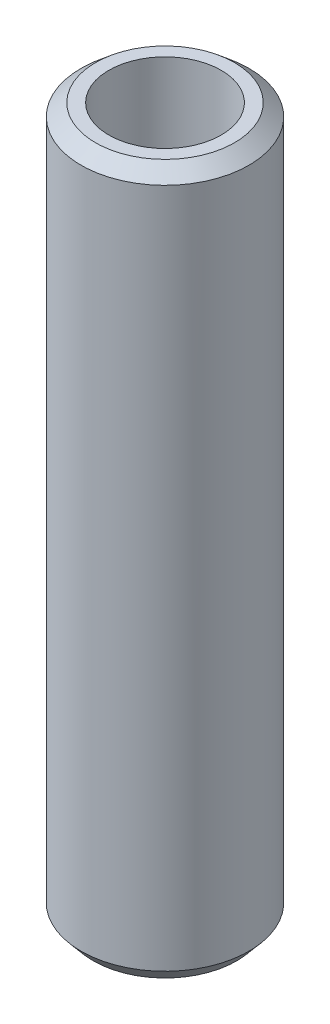
from build123d import *
from OCP.BRepFilletAPI import BRepFilletAPI_MakeChamfer

# Parameters (mm, degrees)
SKETCH1_R           = 20
BOSS_EXTRUDE1_DEPTH = 168.47988063
SKETCH2_R           = 13.376930258
CUT_EXTRUDE1_DEPTH  = 171.837554938
CHAMFER1_SIZE       = 2.912099767
CHAMFER1_SIZE2      = 3.450832047


with BuildPart() as part:
    # Sketch1 → Boss-Extrude1 (new body)
    with BuildSketch(Plane(origin=(0, 0, 0), x_dir=(1, 0, 0), z_dir=(0, 1, 0))):
        Circle(SKETCH1_R)
    extrude(amount=BOSS_EXTRUDE1_DEPTH)

    # Sketch2 → Cut-Extrude1 (cut, through all)
    with BuildSketch(Plane(origin=(0, 0, 0), x_dir=(1, 0, 0), z_dir=(0, 1, 0))):
        Circle(SKETCH2_R)
    extrude(amount=CUT_EXTRUDE1_DEPTH, mode=Mode.SUBTRACT)

    # Chamfer1: one chamfer whose edges measure the first distance from different faces: ONE call of the kernel's chamfer builder (chamfer() names one face for all edges)
    chamfer1_edges_1 = [part.edges().sort_by_distance(p)[0] for p in [
        (-20, 168.47988063, 0),
    ]]
    chamfer1_side_1 = [part.faces().sort_by_distance(p)[0] for p in [
        (-20, 84.239940315, 0),
    ]]
    chamfer1_edges_2 = [part.edges().sort_by_distance(p)[0] for p in [
        (-20, 0, 0),
    ]]
    chamfer1_side_2 = [part.faces().sort_by_distance(p)[0] for p in [
        (-19.434314575, 0, 0),
    ]]
    chamfer1 = BRepFilletAPI_MakeChamfer(part.part.solid().wrapped)
    for e in chamfer1_edges_1:
        chamfer1.Add(CHAMFER1_SIZE, CHAMFER1_SIZE2, e.wrapped, chamfer1_side_1[0].wrapped)  # the first distance lies on this face
    for e in chamfer1_edges_2:
        chamfer1.Add(CHAMFER1_SIZE, CHAMFER1_SIZE2, e.wrapped, chamfer1_side_2[0].wrapped)  # the first distance lies on this face
    add(Compound.cast(chamfer1.Shape()), mode=Mode.REPLACE)


solid = part.part
